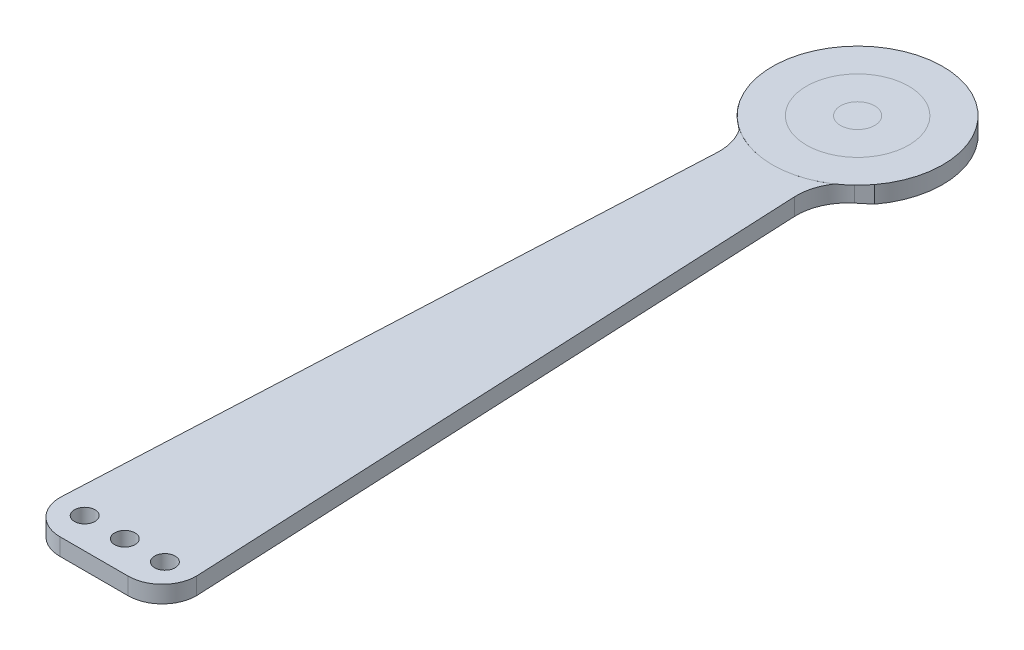
from build123d import *

# Parameters (mm, degrees)
SKETCH2_R           = 25
BOSS_EXTRUDE2_DEPTH = 5
SKETCH3_R           = 15
BOSS_EXTRUDE3_DEPTH = 0.0001
SKETCH4_R           = 5
BOSS_EXTRUDE4_DEPTH = 0.0001
SKETCH20_R          = 3
BOSS_EXTRUDE8_DEPTH = 4.9999
FILLET6_R           = 10
CUT_EXTRUDE4_DEPTH  = 4.9999
FILLET8_R           = 15


with BuildPart() as part:
    # Sketch2 → Boss-Extrude2 (new body)
    with BuildSketch(Plane(origin=(0, 0, 0), x_dir=(1, 0, 0), z_dir=(0, 1, 0))):
        with Locations(Location((0, 0, 0), (0, 0, 270))):
            Circle(SKETCH2_R)
    extrude(amount=BOSS_EXTRUDE2_DEPTH)

    # Sketch3 → Boss-Extrude3 (add)
    with BuildSketch(Plane(origin=(0, 5, 0), x_dir=(1, 0, 0), z_dir=(0, 1, 0))):
        with Locations(Location((0, 0, 0), (0, 0, 270))):
            Circle(SKETCH3_R)
    extrude(amount=BOSS_EXTRUDE3_DEPTH)

    # Sketch4 → Boss-Extrude4 (add)
    with BuildSketch(Plane(origin=(0, 5.0001, 0), x_dir=(1, 0, 0), z_dir=(0, 1, 0))):
        with Locations(Location((0, 0, 0), (0, 0, 270))):
            Circle(SKETCH4_R)
    extrude(amount=BOSS_EXTRUDE4_DEPTH)

    # Sketch20 → Boss-Extrude8 (add)
    with BuildSketch(Plane(origin=(0, 0, 0), x_dir=(1, 0, 0), z_dir=(0, 1, 0))):
        Polygon((20, 0), (20, -224), (-20, -224), (-20, 0), (0, 0), align=None)
        with Locations(Location((-11.77, -215, 0), (0, 0, 270))):
            Circle(SKETCH20_R, mode=Mode.SUBTRACT)
        with Locations(Location((11.77, -215, 0), (0, 0, 270))):
            Circle(SKETCH20_R, mode=Mode.SUBTRACT)
        with Locations(Location((0, -215, 0), (0, 0, 270))):
            Circle(SKETCH20_R, mode=Mode.SUBTRACT)
    extrude(amount=BOSS_EXTRUDE8_DEPTH)

    # Fillet6
    fillet6_edges = [part.edges().sort_by_distance(p)[0] for p in [
        (20, 2.49995, 224),
        (-20, 2.49995, 224),
    ]]
    fillet(fillet6_edges, radius=FILLET6_R)

    # Sketch21 → Cut-Extrude4 (cut)
    with BuildSketch(Plane(origin=(0, 4.9999, 0), x_dir=(1, 0, 0), z_dir=(0, 1, 0))):
        Polygon((20, -214), (11.00508109, -22.44745398), (20, -15), align=None)
        Polygon((-20, -214), (-10.890807236, -22.503117956), (-20, -15), align=None)
    extrude(amount=-CUT_EXTRUDE4_DEPTH, mode=Mode.SUBTRACT)

    # Fillet8
    # the kernel refuses this fillet: 15 mm, written as the material it adds along each edge
    with BuildSketch(Plane(origin=(11.00508109, 4.9999, 22.44745398), x_dir=(0.7702520044264655, 0, -0.6377396409797748), z_dir=(0, -1, 0))) as fillet8_piece_1:
        with BuildLine():
            CenterArc((FILLET8_R * 0.499290509881, FILLET8_R), FILLET8_R, 216.934957366, 53.065042634)
            Line((-FILLET8_R * 0.300027670723, FILLET8_R * 0.399091981951), (0, 0))
            Line((0, 0), (FILLET8_R * 0.499290509881, 0))
        make_face()
    extrude(amount=4.9999)
    with BuildSketch(Plane(origin=(-10.890807236, 4.9999, 22.503117956), x_dir=(-0.04751463426257685, 0, 0.9988705419276782), z_dir=(0, -1, 0))) as fillet8_piece_2:
        with BuildLine():
            CenterArc((FILLET8_R * 0.501260466094, FILLET8_R), FILLET8_R, 216.754404895, 53.245595105)
            Line((-FILLET8_R * 0.299947345081, FILLET8_R * 0.401613800867), (0, 0))
            Line((0, 0), (FILLET8_R * 0.501260466094, 0))
        make_face()
    extrude(amount=4.9999)


solid = part.part
